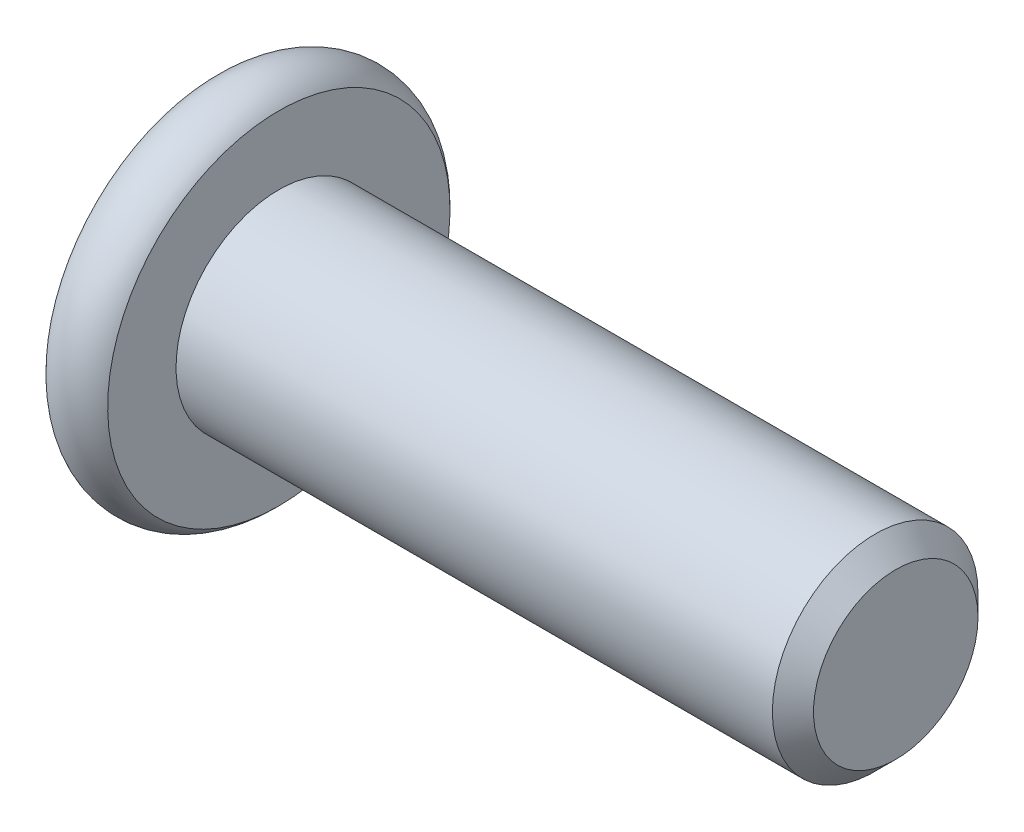
from build123d import *

# Parameters (mm, degrees)
SKETCH2_R           = 2.5
BOSS_EXTRUDE1_DEPTH = 15
CHAMFER1_SIZE       = 0.5
CUT_EXTRUDE1_DEPTH  = 2.3
SKETCH8_R           = 1.782050808
CUT_EXTRUDE2_DEPTH  = 1
CUT_EXTRUDE2_DRAFT  = -45


with BuildPart() as part:
    # Sketch2 → Boss-Extrude1 (new body)
    with BuildSketch(Plane(origin=(0, 0, 0), x_dir=(0, 0, -1), z_dir=(1, 0, 0))):
        Circle(SKETCH2_R)
    extrude(amount=-BOSS_EXTRUDE1_DEPTH)

    # Chamfer1
    chamfer1_edges = [part.edges().sort_by_distance(p)[0] for p in [
        (0, 0, 2.5),
    ]]
    chamfer(chamfer1_edges, length=CHAMFER1_SIZE)

    # Sketch6 → Revolve1 (revolve)
    with BuildSketch(Plane.XY):
        with BuildLine():
            Line((-16.5, 0), (-16.5, 4.161437828))
            ThreePointArc((-16.5, 4.161437828), (-15.75, 4.5), (-15, 4.161437828))
            Line((-15, 4.161437828), (-15, 0))
            Line((-15, 0), (-16.5, 0))
        make_face()
    revolve(axis=Axis((-15, 0, 0), (1, 0, 0)))

    # Sketch7 → Cut-Extrude1 (cut)
    with BuildSketch(Plane.ZY.offset(16.5)):
        Polygon((0, 1.732050808), (-1.5, 0.866025404), (-1.5, -0.866025404), (0, -1.732050808), (1.5, -0.866025404), (1.5, 0.866025404), align=None)
    extrude(amount=-CUT_EXTRUDE1_DEPTH, mode=Mode.SUBTRACT)


with BuildPart() as cut_extrude2_tool:
    # Sketch8 → Cut-Extrude2 (with draft: the straight prism first)
    with BuildSketch(Plane.ZY.offset(16.5)):
        Circle(SKETCH8_R)
    extrude(amount=-CUT_EXTRUDE2_DEPTH)
    # Cut-Extrude2: the draft: its side faces are tilted about the plane it starts from
    cut_extrude2_sides = [cut_extrude2_tool.faces().sort_by_distance(p)[0] for p in [
        (-16, 0, -1.782050808),
    ]]
    draft(cut_extrude2_sides, Plane.ZY.offset(16.5), CUT_EXTRUDE2_DRAFT)


with BuildPart() as part_1:
    add(part.part)

    # Cut-Extrude2: cut by cut_extrude2_tool
    add(cut_extrude2_tool.part, mode=Mode.SUBTRACT)


solid = part_1.part
